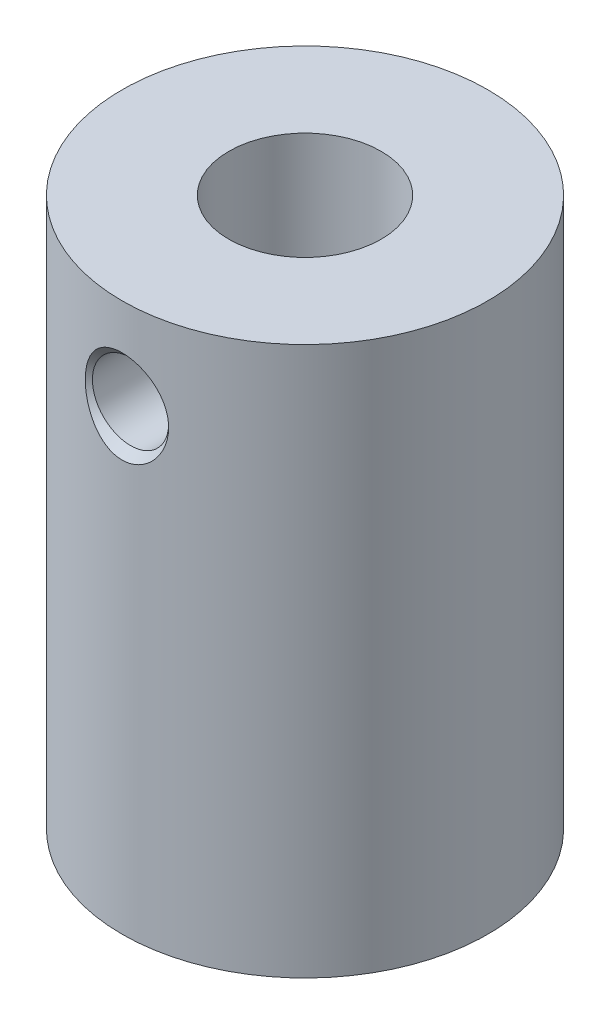
from build123d import *

# Parameters (mm, degrees)
SKETCH1_R                   = 6
SKETCH1_R_2                 = 2.5
BOSS_EXTRUDE1_DEPTH         = 18
M6_TAPPED_HOLE1_D           = 5
M6_TAPPED_HOLE1_DEPTH       = 10
M6_TAPPED_HOLE1_CSINK_D     = 6.05
M6_TAPPED_HOLE1_CSINK_ANGLE = 90
M6_TAPPED_HOLE1_TIP         = 1.502151548


# Read off the part's stored shape, not the designer's step: M3 Tapped Hole1
with BuildPart() as part:
    # Sketch1 → Boss-Extrude1 (new body)
    with BuildSketch(Plane(origin=(0, 0, 0), x_dir=(1, 0, 0), z_dir=(0, 1, 0))):
        with Locations(Location((0, 0, 0), (0, 0, 270))):
            Circle(SKETCH1_R)
        with Locations(Location((0, 0, 0), (0, 0, 270))):
            Circle(SKETCH1_R_2, mode=Mode.SUBTRACT)
    extrude(amount=BOSS_EXTRUDE1_DEPTH)

    # M3 Tapped Hole1 outline → M3 Tapped Hole1 (revolve, cut)
    with BuildSketch(Plane.XZ.offset(-15)):
        Polygon((1.25, 6.000000084), (1.25, 5.725), (1.525000084, 6.000000084), align=None)
        Polygon((1.25, 2.775), (1.25, 5.725), (1.25, 6.000000084), (0, 6.000000084), (0, 1.980737508), (1.25, 1.980737508), align=None)
        Polygon((1.525, 2.5), (1.25, 2.775), (1.25, 1.980737508), (1.525000084, 1.980737508), align=None)
    revolve(axis=Axis((0, 15, 0), (0, 0, 1)), mode=Mode.SUBTRACT)

    # M6 Tapped Hole1
    with Locations(Plane.XZ):
        with Locations((0, 0)):
            CounterSinkHole(M6_TAPPED_HOLE1_D / 2, M6_TAPPED_HOLE1_CSINK_D / 2, depth=M6_TAPPED_HOLE1_DEPTH, counter_sink_angle=M6_TAPPED_HOLE1_CSINK_ANGLE)
            with Locations((0, 0, -(M6_TAPPED_HOLE1_DEPTH + M6_TAPPED_HOLE1_TIP / 2))):  # 118° drill point
                Cone(0, M6_TAPPED_HOLE1_D / 2, M6_TAPPED_HOLE1_TIP, mode=Mode.SUBTRACT)


solid = part.part
